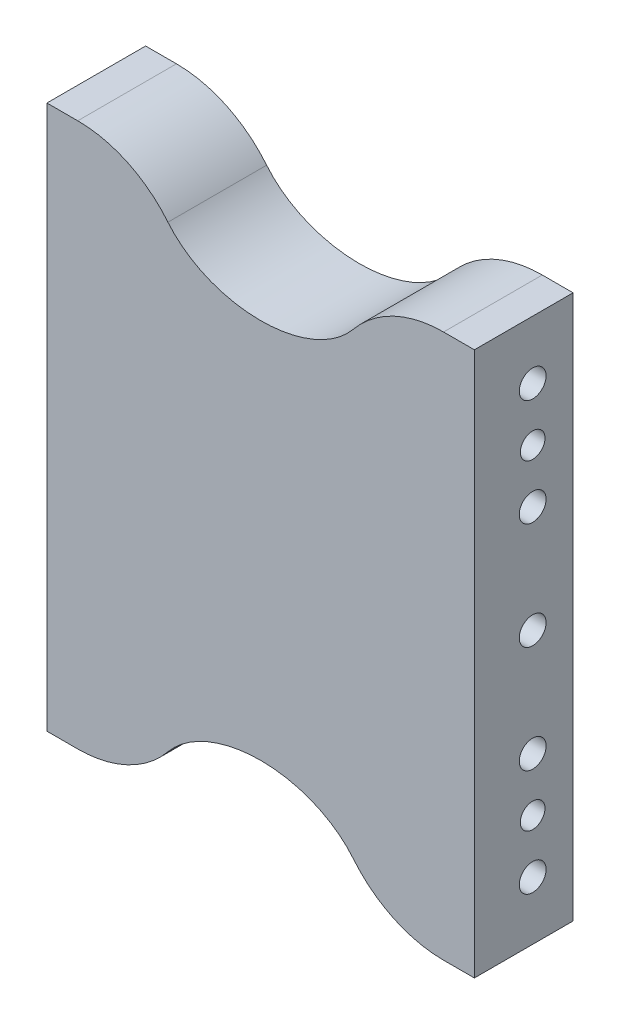
from build123d import *

# Parameters (mm, degrees)
SKETCH1_W                           = 55
SKETCH1_H                           = 70
BOSS_EXTRUDE1_DEPTH                 = 12.7
SKETCH21_RX                         = 14
SKETCH21_RY                         = 10.5
CUT_EXTRUDE1_DEPTH                  = 47.287579328
FILLET2_START                       = -1
FILLET2_DEPTH                       = 15
F_8_32_TAPPED_HOLE1_AT_2_COUNT      = 2
F_8_32_TAPPED_HOLE1_AT_2_PITCH      = 13.75
F_8_32_TAPPED_HOLE1_AT_3_COUNT      = 2
F_8_32_TAPPED_HOLE1_AT_3_PITCH      = 27.5
F_8_32_TAPPED_HOLE1_AT_4_COUNT      = 2
F_8_32_TAPPED_HOLE1_AT_4_PITCH      = 55
F_8_32_TAPPED_HOLE1_AT_5_COUNT      = 2
F_8_32_TAPPED_HOLE1_AT_5_PITCH      = 41.25
F_1_8_0_1250_DOWEL_HOLE1_AT_2_COUNT = 2
F_1_8_0_1250_DOWEL_HOLE1_AT_2_PITCH = 41.25


with BuildPart() as part:
    # Sketch1 → Boss-Extrude1 (new body)
    with BuildSketch(Plane.XY):
        Rectangle(SKETCH1_W, SKETCH1_H)
    extrude(amount=BOSS_EXTRUDE1_DEPTH)

    # Sketch21 → Cut-Extrude1 (cut, through all)
    with BuildSketch(Plane.XY.offset(12.7)):
        with Locations((0, 35)):
            Ellipse(SKETCH21_RX, SKETCH21_RY)
        with Locations((0, -35)):
            Ellipse(SKETCH21_RX, SKETCH21_RY)
    extrude(amount=-CUT_EXTRUDE1_DEPTH, mode=Mode.SUBTRACT)

    # Fillet2: read off the stored shape, not the designer's step
    # Fillet2 outline → Fillet2 (cut)
    with BuildSketch(Plane.XY.offset(FILLET2_START)):
        with BuildLine():
            ThreePointArc((-23.533885883, 35), (-17.113783845, 33.556632687), (-11.929223863, 29.504305309))
            add(Edge.make_bspline(
                [(-14, 35), (-14, 32.032702325), (-11.929223863, 29.504305309)],
                knots=[3.141592654, 3.141592654, 3.141592654, 3.703586408, 3.703586408, 3.703586408], degree=2, weights=[1, 0.895209737, 0.865402427]))
            Line((-14, 35), (-23.533885883, 35))
        make_face()
        with BuildLine():
            add(Edge.make_bspline(
                [(11.929223863, 29.504305309), (14, 32.032702325), (14, 35)],
                knots=[5.721191552, 5.721191552, 5.721191552, 6.283185307, 6.283185307, 6.283185307], degree=2, weights=[0.865402427, 0.895209737, 1]))
            ThreePointArc((11.929223863, 29.504305309), (17.113783845, 33.556632687), (23.533885883, 35))
            Line((23.533885883, 35), (14, 35))
        make_face()
        with BuildLine():
            ThreePointArc((23.533885883, -35), (17.113783845, -33.556632687), (11.929223863, -29.504305309))
            add(Edge.make_bspline(
                [(14, -35), (14, -32.032702325), (11.929223863, -29.504305309)],
                knots=[0, 0, 0, 0.561993755, 0.561993755, 0.561993755], degree=2, weights=[1, 0.895209737, 0.865402427]))
            Line((14, -35), (23.533885883, -35))
        make_face()
        with BuildLine():
            add(Edge.make_bspline(
                [(-11.929223863, -29.504305309), (-14, -32.032702325), (-14, -35)],
                knots=[2.579598899, 2.579598899, 2.579598899, 3.141592654, 3.141592654, 3.141592654], degree=2, weights=[0.865402427, 0.895209737, 1]))
            ThreePointArc((-11.929223863, -29.504305309), (-17.113783845, -33.556632687), (-23.533885883, -35))
            Line((-23.533885883, -35), (-14, -35))
        make_face()
    extrude(amount=FILLET2_DEPTH, mode=Mode.SUBTRACT)

    # Sketch16 → #8-32 Tapped Hole1 (revolve, cut)
    with BuildSketch(Plane(origin=(27.5, -27.5, 5.2), x_dir=(0, 0, -1), z_dir=(0, 1, 0))):
        Polygon((0, 0), (0, 11.747806461), (1.7272, 10.71), (1.7272, 0), align=None)
    f_8_32_tapped_hole1 = revolve(axis=Axis((33.85, -27.5, 5.2), (-1, 0, 0)), mode=Mode.SUBTRACT)

    # #8-32 Tapped Hole1 at 2: #8-32 Tapped Hole1 ×2
    with Locations(*[(0, i * F_8_32_TAPPED_HOLE1_AT_2_PITCH, 0) for i in range(1, F_8_32_TAPPED_HOLE1_AT_2_COUNT)]):
        add(f_8_32_tapped_hole1, mode=Mode.SUBTRACT)

    # #8-32 Tapped Hole1 at 3: #8-32 Tapped Hole1 ×2
    with Locations(*[(0, i * F_8_32_TAPPED_HOLE1_AT_3_PITCH, 0) for i in range(1, F_8_32_TAPPED_HOLE1_AT_3_COUNT)]):
        add(f_8_32_tapped_hole1, mode=Mode.SUBTRACT)

    # #8-32 Tapped Hole1 at 4: #8-32 Tapped Hole1 ×2
    with Locations(*[(0, i * F_8_32_TAPPED_HOLE1_AT_4_PITCH, 0) for i in range(1, F_8_32_TAPPED_HOLE1_AT_4_COUNT)]):
        add(f_8_32_tapped_hole1, mode=Mode.SUBTRACT)

    # #8-32 Tapped Hole1 at 5: #8-32 Tapped Hole1 ×2
    with Locations(*[(0, i * F_8_32_TAPPED_HOLE1_AT_5_PITCH, 0) for i in range(1, F_8_32_TAPPED_HOLE1_AT_5_COUNT)]):
        add(f_8_32_tapped_hole1, mode=Mode.SUBTRACT)

    # Sketch20 → 1/8 (0.1250) Dowel Hole1 (revolve, cut)
    with BuildSketch(Plane(origin=(27.5, -20.625, 5.2), x_dir=(0, 0, -1), z_dir=(0, 1, 0))):
        Polygon((0, 0), (0, 4.953866233), (1.5875, 4), (1.5875, 0), align=None)
    f_1_8_0_1250_dowel_hole1 = revolve(axis=Axis((33.85, -20.625, 5.2), (-1, 0, 0)), mode=Mode.SUBTRACT)

    # 1/8 (0.1250) Dowel Hole1 at 2: 1/8 (0.1250) Dowel Hole1 ×2
    with Locations(*[(0, i * F_1_8_0_1250_DOWEL_HOLE1_AT_2_PITCH, 0) for i in range(1, F_1_8_0_1250_DOWEL_HOLE1_AT_2_COUNT)]):
        add(f_1_8_0_1250_dowel_hole1, mode=Mode.SUBTRACT)

    # Mirror1: #8-32 Tapped Hole1, 1/8 (0.1250) Dowel Hole1 across plane
    add(f_8_32_tapped_hole1.mirror(Plane(origin=(0, 0, 0), x_dir=(0, 0, 1), z_dir=(1, 0, 0))), mode=Mode.SUBTRACT)
    add(f_1_8_0_1250_dowel_hole1.mirror(Plane(origin=(0, 0, 0), x_dir=(0, 0, 1), z_dir=(1, 0, 0))), mode=Mode.SUBTRACT)

    # Mirror1 copy 1 sketch → Mirror1 copy 1 (revolve, cut)
    with BuildSketch(Plane(origin=(-27.5, -13.75, 5.2), x_dir=(0, 0, -1), z_dir=(0, 1, 0))):
        Polygon((0, 0), (0, -11.747806461), (1.7272, -10.71), (1.7272, 0), align=None)
    revolve(axis=Axis((-33.85, -13.75, 5.2), (-1, 0, 0)), mode=Mode.SUBTRACT)

    # Mirror1 copy 2 sketch → Mirror1 copy 2 (revolve, cut)
    with BuildSketch(Plane(origin=(-27.5, 0, 5.2), x_dir=(0, 0, -1), z_dir=(0, 1, 0))):
        Polygon((0, 0), (0, -11.747806461), (1.7272, -10.71), (1.7272, 0), align=None)
    revolve(axis=Axis((-33.85, 0, 5.2), (-1, 0, 0)), mode=Mode.SUBTRACT)

    # Mirror1 copy 3 sketch → Mirror1 copy 3 (revolve, cut)
    with BuildSketch(Plane(origin=(-27.5, 27.5, 5.2), x_dir=(0, 0, -1), z_dir=(0, 1, 0))):
        Polygon((0, 0), (0, -11.747806461), (1.7272, -10.71), (1.7272, 0), align=None)
    revolve(axis=Axis((-33.85, 27.5, 5.2), (-1, 0, 0)), mode=Mode.SUBTRACT)

    # Mirror1 copy 4 sketch → Mirror1 copy 4 (revolve, cut)
    with BuildSketch(Plane(origin=(-27.5, 13.75, 5.2), x_dir=(0, 0, -1), z_dir=(0, 1, 0))):
        Polygon((0, 0), (0, -11.747806461), (1.7272, -10.71), (1.7272, 0), align=None)
    revolve(axis=Axis((-33.85, 13.75, 5.2), (-1, 0, 0)), mode=Mode.SUBTRACT)

    # Mirror1 copy 5 sketch → Mirror1 copy 5 (revolve, cut)
    with BuildSketch(Plane(origin=(-27.5, 20.625, 5.2), x_dir=(0, 0, -1), z_dir=(0, 1, 0))):
        Polygon((0, 0), (0, -4.953866233), (1.5875, -4), (1.5875, 0), align=None)
    revolve(axis=Axis((-33.85, 20.625, 5.2), (-1, 0, 0)), mode=Mode.SUBTRACT)


solid = part.part
